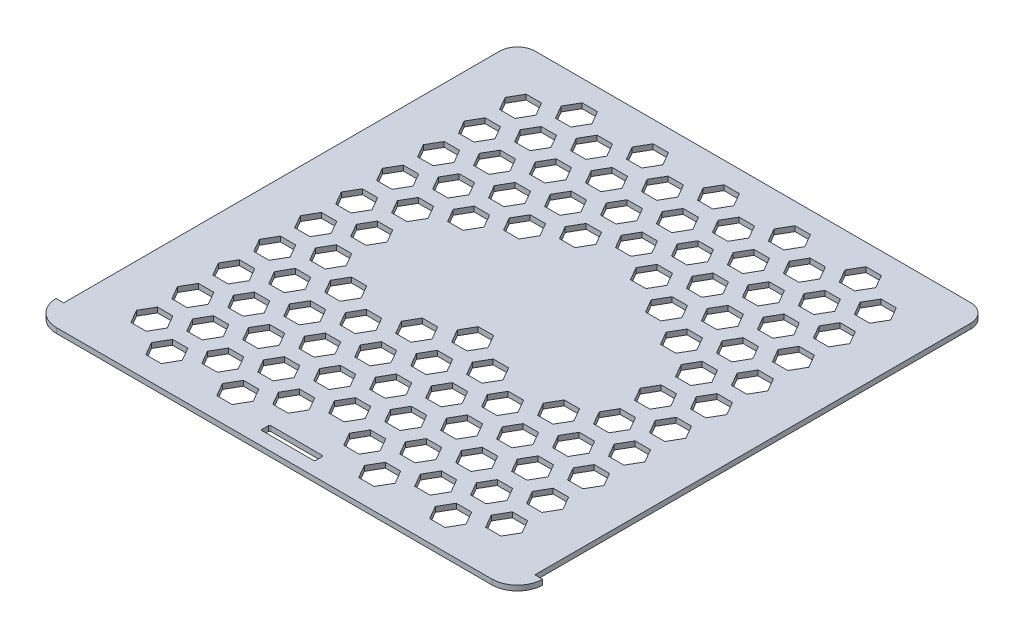
from build123d import *

# Parameters (mm, degrees)
ESQUISSE1_W                     = 184
ESQUISSE1_H                     = 187
BOSS_EXTRU_1_DEPTH              = 2
CONG_1_R                        = 7
ENL_V_MAT_EXTRU_1_DEPTH         = 132.187842425
BOSS_EXTRU_2_DEPTH              = 2
R_P_TITION_DANS_UNE_ZONE1_DEPTH = 2
ENL_V_MAT_EXTRU_2_REACH         = 135.307
ESQUISSE4_W                     = 21
ESQUISSE4_H                     = 3.4
CONG_2_R                        = 0.5


# Read off the part's stored shape, not the designer's step: Répétition dans une zone1
with BuildPart() as part:
    # Esquisse1 → Boss.-Extru.1 (new body)
    with BuildSketch(Plane(origin=(0, 0, 0), x_dir=(1, 0, 0), z_dir=(0, 1, 0))):
        Rectangle(ESQUISSE1_W, ESQUISSE1_H)
    extrude(amount=BOSS_EXTRU_1_DEPTH)

    # Congé1
    cong_1_edges = [part.edges().sort_by_distance(p)[0] for p in [
        (-92, 1, -93.5),
        (92, 1, -93.5),
    ]]
    fillet(cong_1_edges, radius=CONG_1_R)

    # Esquisse2 → Enlèv. mat.-Extru.1 (cut, through all)
    with BuildSketch(Plane(origin=(0, 2, 0), x_dir=(1, 0, 0), z_dir=(0, 1, 0))):
        with BuildLine():
            Line((-92, -90.641428429), (-92, -93.5))
            Line((-92, -93.5), (-85, -93.5))
            ThreePointArc((-85, -93.5), (-88.780589618, -92.757815193), (-92, -90.641428429))
        make_face()
    enl_v_mat_extru_1 = extrude(amount=-ENL_V_MAT_EXTRU_1_DEPTH, mode=Mode.SUBTRACT)

    # Esquisse3 → Boss.-Extru.2 (add)
    with BuildSketch(Plane(origin=(0, 2, 0), x_dir=(1, 0, 0), z_dir=(0, 1, 0))):
        with BuildLine():
            Line((-94.9979998, -83.7), (-92, -83.7))
            Line((-92, -83.7), (-92, -90.641428429))
            ThreePointArc((-92, -90.641428429), (-94.180351652, -87.464989728), (-94.9979998, -83.7))
        make_face()
    boss_extru_2 = extrude(amount=-BOSS_EXTRU_2_DEPTH)

    # Symétrie1: Enlèv. mat.-Extru.1, Boss.-Extru.2 across plane
    add(enl_v_mat_extru_1.mirror(Plane(origin=(0, 0, 0), x_dir=(0, 0, 1), z_dir=(1, 0, 0))), mode=Mode.SUBTRACT)
    add(boss_extru_2.mirror(Plane(origin=(0, 0, 0), x_dir=(0, 0, 1), z_dir=(1, 0, 0))))

    # Répétition dans une zone1 outline → Répétition dans une zone1 (cut)
    with BuildSketch(Plane(origin=(0, 0, 0), x_dir=(1, 0, 0), z_dir=(0, 1, 0))):
        Polygon((58.425625842, 74.803847577), (61.425625842, 80), (58.425625842, 85.196152423), (52.425625842, 85.196152423), (49.425625842, 80), (52.425625842, 74.803847577), align=None)
        Polygon((30.712812921, 26.803847577), (33.712812921, 32), (30.712812921, 37.196152423), (24.712812921, 37.196152423), (21.712812921, 32), (24.712812921, 26.803847577), align=None)
        Polygon((-10.856406461, -45.196152423), (-7.856406461, -40), (-10.856406461, -34.803847577), (-16.856406461, -34.803847577), (-19.856406461, -40), (-16.856406461, -45.196152423), align=None)
        Polygon((-24.712812921, -69.196152423), (-21.712812921, -64), (-24.712812921, -58.803847577), (-30.712812921, -58.803847577), (-33.712812921, -64), (-30.712812921, -69.196152423), align=None)
        Polygon((3, -21.196152423), (6, -16), (3, -10.803847577), (-3, -10.803847577), (-6, -16), (-3, -21.196152423), align=None)
        Polygon((44.569219382, 50.803847577), (47.569219382, 56), (44.569219382, 61.196152423), (38.569219382, 61.196152423), (35.569219382, 56), (38.569219382, 50.803847577), align=None)
        Polygon((75.282032303, 56), (72.282032303, 61.196152423), (66.282032303, 61.196152423), (63.282032303, 56), (66.282032303, 50.803847577), (72.282032303, 50.803847577), align=None)
        Polygon((-52.425625842, 85.196152423), (-58.425625842, 85.196152423), (-61.425625842, 80), (-58.425625842, 74.803847577), (-52.425625842, 74.803847577), (-49.425625842, 80), align=None)
        Polygon((-24.712812921, 85.196152423), (-30.712812921, 85.196152423), (-33.712812921, 80), (-30.712812921, 74.803847577), (-24.712812921, 74.803847577), (-21.712812921, 80), align=None)
        Polygon((30.712812921, 85.196152423), (24.712812921, 85.196152423), (21.712812921, 80), (24.712812921, 74.803847577), (30.712812921, 74.803847577), (33.712812921, 80), align=None)
        Polygon((3, 85.196152423), (-3, 85.196152423), (-6, 80), (-3, 74.803847577), (3, 74.803847577), (6, 80), align=None)
        Polygon((44.569219382, 18.803847577), (47.569219382, 24), (44.569219382, 29.196152423), (38.569219382, 29.196152423), (35.569219382, 24), (38.569219382, 18.803847577), align=None)
        Polygon((16.856406461, -29.196152423), (19.856406461, -24), (16.856406461, -18.803847577), (10.856406461, -18.803847577), (7.856406461, -24), (10.856406461, -29.196152423), align=None)
        Polygon((72.282032303, 66.803847577), (75.282032303, 72), (72.282032303, 77.196152423), (66.282032303, 77.196152423), (63.282032303, 72), (66.282032303, 66.803847577), align=None)
        Polygon((58.425625842, 42.803847577), (61.425625842, 48), (58.425625842, 53.196152423), (52.425625842, 53.196152423), (49.425625842, 48), (52.425625842, 42.803847577), align=None)
        Polygon((3, -53.196152423), (6, -48), (3, -42.803847577), (-3, -42.803847577), (-6, -48), (-3, -53.196152423), align=None)
        Polygon((-10.856406461, -77.196152423), (-7.856406461, -72), (-10.856406461, -66.803847577), (-16.856406461, -66.803847577), (-19.856406461, -72), (-16.856406461, -77.196152423), align=None)
        Polygon((75.282032303, -24), (72.282032303, -18.803847577), (66.282032303, -18.803847577), (63.282032303, -24), (66.282032303, -29.196152423), (72.282032303, -29.196152423), align=None)
        Polygon((61.425625842, 0), (58.425625842, 5.196152423), (52.425625842, 5.196152423), (49.425625842, 0), (52.425625842, -5.196152423), (58.425625842, -5.196152423), align=None)
        Polygon((19.856406461, 72), (16.856406461, 77.196152423), (10.856406461, 77.196152423), (7.856406461, 72), (10.856406461, 66.803847577), (16.856406461, 66.803847577), align=None)
        Polygon((33.712812921, 48), (30.712812921, 53.196152423), (24.712812921, 53.196152423), (21.712812921, 48), (24.712812921, 42.803847577), (30.712812921, 42.803847577), align=None)
        Polygon((72.282032303, 29.196152423), (66.282032303, 29.196152423), (63.282032303, 24), (66.282032303, 18.803847577), (72.282032303, 18.803847577), (75.282032303, 24), align=None)
        Polygon((-66.282032303, 29.196152423), (-72.282032303, 29.196152423), (-75.282032303, 24), (-72.282032303, 18.803847577), (-66.282032303, 18.803847577), (-63.282032303, 24), align=None)
        Polygon((-38.569219382, 29.196152423), (-44.569219382, 29.196152423), (-47.569219382, 24), (-44.569219382, 18.803847577), (-38.569219382, 18.803847577), (-35.569219382, 24), align=None)
        Polygon((30.712812921, -37.196152423), (33.712812921, -32), (30.712812921, -26.803847577), (24.712812921, -26.803847577), (21.712812921, -32), (24.712812921, -37.196152423), align=None)
        Polygon((58.425625842, 10.803847577), (61.425625842, 16), (58.425625842, 21.196152423), (52.425625842, 21.196152423), (49.425625842, 16), (52.425625842, 10.803847577), align=None)
        Polygon((16.856406461, -61.196152423), (19.856406461, -56), (16.856406461, -50.803847577), (10.856406461, -50.803847577), (7.856406461, -56), (10.856406461, -61.196152423), align=None)
        Polygon((72.282032303, 34.803847577), (75.282032303, 40), (72.282032303, 45.196152423), (66.282032303, 45.196152423), (63.282032303, 40), (66.282032303, 34.803847577), align=None)
        Polygon((61.425625842, -80), (58.425625842, -74.803847577), (52.425625842, -74.803847577), (49.425625842, -80), (52.425625842, -85.196152423), (58.425625842, -85.196152423), align=None)
        Polygon((47.569219382, -56), (44.569219382, -50.803847577), (38.569219382, -50.803847577), (35.569219382, -56), (38.569219382, -61.196152423), (44.569219382, -61.196152423), align=None)
        Polygon((-7.856406461, 40), (-10.856406461, 45.196152423), (-16.856406461, 45.196152423), (-19.856406461, 40), (-16.856406461, 34.803847577), (-10.856406461, 34.803847577), align=None)
        Polygon((-21.712812921, 64), (-24.712812921, 69.196152423), (-30.712812921, 69.196152423), (-33.712812921, 64), (-30.712812921, 58.803847577), (-24.712812921, 58.803847577), align=None)
        Polygon((58.425625842, -26.803847577), (52.425625842, -26.803847577), (49.425625842, -32), (52.425625842, -37.196152423), (58.425625842, -37.196152423), (61.425625842, -32), align=None)
        Polygon((-52.425625842, -26.803847577), (-58.425625842, -26.803847577), (-61.425625842, -32), (-58.425625842, -37.196152423), (-52.425625842, -37.196152423), (-49.425625842, -32), align=None)
        Polygon((3, -26.803847577), (-3, -26.803847577), (-6, -32), (-3, -37.196152423), (3, -37.196152423), (6, -32), align=None)
        Polygon((-24.712812921, -26.803847577), (-30.712812921, -26.803847577), (-33.712812921, -32), (-30.712812921, -37.196152423), (-24.712812921, -37.196152423), (-21.712812921, -32), align=None)
        Polygon((30.712812921, -53.196152423), (33.712812921, -48), (30.712812921, -42.803847577), (24.712812921, -42.803847577), (21.712812921, -48), (24.712812921, -53.196152423), align=None)
        Polygon((44.569219382, -29.196152423), (47.569219382, -24), (44.569219382, -18.803847577), (38.569219382, -18.803847577), (35.569219382, -24), (38.569219382, -29.196152423), align=None)
        Polygon((16.856406461, -77.196152423), (19.856406461, -72), (16.856406461, -66.803847577), (10.856406461, -66.803847577), (7.856406461, -72), (10.856406461, -77.196152423), align=None)
        Polygon((47.569219382, -72), (44.569219382, -66.803847577), (38.569219382, -66.803847577), (35.569219382, -72), (38.569219382, -77.196152423), (44.569219382, -77.196152423), align=None)
        Polygon((-35.569219382, 72), (-38.569219382, 77.196152423), (-44.569219382, 77.196152423), (-47.569219382, 72), (-44.569219382, 66.803847577), (-38.569219382, 66.803847577), align=None)
        Polygon((-21.712812921, 48), (-24.712812921, 53.196152423), (-30.712812921, 53.196152423), (-33.712812921, 48), (-30.712812921, 42.803847577), (-24.712812921, 42.803847577), align=None)
        Polygon((58.425625842, -42.803847577), (52.425625842, -42.803847577), (49.425625842, -48), (52.425625842, -53.196152423), (58.425625842, -53.196152423), (61.425625842, -48), align=None)
        Polygon((-52.425625842, -42.803847577), (-58.425625842, -42.803847577), (-61.425625842, -48), (-58.425625842, -53.196152423), (-52.425625842, -53.196152423), (-49.425625842, -48), align=None)
        Polygon((-24.712812921, -42.803847577), (-30.712812921, -42.803847577), (-33.712812921, -48), (-30.712812921, -53.196152423), (-24.712812921, -53.196152423), (-21.712812921, -48), align=None)
        Polygon((30.712812921, -69.196152423), (33.712812921, -64), (30.712812921, -58.803847577), (24.712812921, -58.803847577), (21.712812921, -64), (24.712812921, -69.196152423), align=None)
        Polygon((44.569219382, -45.196152423), (47.569219382, -40), (44.569219382, -34.803847577), (38.569219382, -34.803847577), (35.569219382, -40), (38.569219382, -45.196152423), align=None)
        Polygon((72.282032303, 2.803847577), (75.282032303, 8), (72.282032303, 13.196152423), (66.282032303, 13.196152423), (63.282032303, 8), (66.282032303, 2.803847577), align=None)
        Polygon((58.425625842, -21.196152423), (61.425625842, -16), (58.425625842, -10.803847577), (52.425625842, -10.803847577), (49.425625842, -16), (52.425625842, -21.196152423), align=None)
        Polygon((19.856406461, -40), (16.856406461, -34.803847577), (10.856406461, -34.803847577), (7.856406461, -40), (10.856406461, -45.196152423), (16.856406461, -45.196152423), align=None)
        Polygon((-35.569219382, 56), (-38.569219382, 61.196152423), (-44.569219382, 61.196152423), (-47.569219382, 56), (-44.569219382, 50.803847577), (-38.569219382, 50.803847577), align=None)
        Polygon((-21.712812921, 32), (-24.712812921, 37.196152423), (-30.712812921, 37.196152423), (-33.712812921, 32), (-30.712812921, 26.803847577), (-24.712812921, 26.803847577), align=None)
        Polygon((3, -58.803847577), (-3, -58.803847577), (-6, -64), (-3, -69.196152423), (3, -69.196152423), (6, -64), align=None)
        Polygon((58.425625842, -58.803847577), (52.425625842, -58.803847577), (49.425625842, -64), (52.425625842, -69.196152423), (58.425625842, -69.196152423), (61.425625842, -64), align=None)
        Polygon((-52.425625842, -58.803847577), (-58.425625842, -58.803847577), (-61.425625842, -64), (-58.425625842, -69.196152423), (-52.425625842, -69.196152423), (-49.425625842, -64), align=None)
        Polygon((-7.856406461, 56), (-10.856406461, 61.196152423), (-16.856406461, 61.196152423), (-19.856406461, 56), (-16.856406461, 50.803847577), (-10.856406461, 50.803847577), align=None)
        Polygon((72.282032303, -34.803847577), (66.282032303, -34.803847577), (63.282032303, -40), (66.282032303, -45.196152423), (72.282032303, -45.196152423), (75.282032303, -40), align=None)
        Polygon((-66.282032303, -34.803847577), (-72.282032303, -34.803847577), (-75.282032303, -40), (-72.282032303, -45.196152423), (-66.282032303, -45.196152423), (-63.282032303, -40), align=None)
        Polygon((-38.569219382, -34.803847577), (-44.569219382, -34.803847577), (-47.569219382, -40), (-44.569219382, -45.196152423), (-38.569219382, -45.196152423), (-35.569219382, -40), align=None)
        Polygon((75.282032303, -72), (72.282032303, -66.803847577), (66.282032303, -66.803847577), (63.282032303, -72), (66.282032303, -77.196152423), (72.282032303, -77.196152423), align=None)
        Polygon((-7.856406461, 72), (-10.856406461, 77.196152423), (-16.856406461, 77.196152423), (-19.856406461, 72), (-16.856406461, 66.803847577), (-10.856406461, 66.803847577), align=None)
        Polygon((6, 48), (3, 53.196152423), (-3, 53.196152423), (-6, 48), (-3, 42.803847577), (3, 42.803847577), align=None)
        Polygon((-66.282032303, -18.803847577), (-72.282032303, -18.803847577), (-75.282032303, -24), (-72.282032303, -29.196152423), (-66.282032303, -29.196152423), (-63.282032303, -24), align=None)
        Polygon((-10.856406461, -18.803847577), (-16.856406461, -18.803847577), (-19.856406461, -24), (-16.856406461, -29.196152423), (-10.856406461, -29.196152423), (-7.856406461, -24), align=None)
        Polygon((-38.569219382, -18.803847577), (-44.569219382, -18.803847577), (-47.569219382, -24), (-44.569219382, -29.196152423), (-38.569219382, -29.196152423), (-35.569219382, -24), align=None)
        Polygon((75.282032303, -8), (72.282032303, -2.803847577), (66.282032303, -2.803847577), (63.282032303, -8), (66.282032303, -13.196152423), (72.282032303, -13.196152423), align=None)
        Polygon((33.712812921, 64), (30.712812921, 69.196152423), (24.712812921, 69.196152423), (21.712812921, 64), (24.712812921, 58.803847577), (30.712812921, 58.803847577), align=None)
        Polygon((47.569219382, 40), (44.569219382, 45.196152423), (38.569219382, 45.196152423), (35.569219382, 40), (38.569219382, 34.803847577), (44.569219382, 34.803847577), align=None)
        Polygon((-52.425625842, 21.196152423), (-58.425625842, 21.196152423), (-61.425625842, 16), (-58.425625842, 10.803847577), (-52.425625842, 10.803847577), (-49.425625842, 16), align=None)
        Polygon((30.712812921, -85.196152423), (33.712812921, -80), (30.712812921, -74.803847577), (24.712812921, -74.803847577), (21.712812921, -80), (24.712812921, -85.196152423), align=None)
        Polygon((-49.425625842, 64), (-52.425625842, 69.196152423), (-58.425625842, 69.196152423), (-61.425625842, 64), (-58.425625842, 58.803847577), (-52.425625842, 58.803847577), align=None)
        Polygon((-35.569219382, 40), (-38.569219382, 45.196152423), (-44.569219382, 45.196152423), (-47.569219382, 40), (-44.569219382, 34.803847577), (-38.569219382, 34.803847577), align=None)
        Polygon((-52.425625842, -74.803847577), (-58.425625842, -74.803847577), (-61.425625842, -80), (-58.425625842, -85.196152423), (-52.425625842, -85.196152423), (-49.425625842, -80), align=None)
        Polygon((-24.712812921, -74.803847577), (-30.712812921, -74.803847577), (-33.712812921, -80), (-30.712812921, -85.196152423), (-24.712812921, -85.196152423), (-21.712812921, -80), align=None)
        Polygon((19.856406461, 56), (16.856406461, 61.196152423), (10.856406461, 61.196152423), (7.856406461, 56), (10.856406461, 50.803847577), (16.856406461, 50.803847577), align=None)
        Polygon((58.425625842, 37.196152423), (52.425625842, 37.196152423), (49.425625842, 32), (52.425625842, 26.803847577), (58.425625842, 26.803847577), (61.425625842, 32), align=None)
        Polygon((-52.425625842, 37.196152423), (-58.425625842, 37.196152423), (-61.425625842, 32), (-58.425625842, 26.803847577), (-52.425625842, 26.803847577), (-49.425625842, 32), align=None)
        Polygon((-63.282032303, 56), (-66.282032303, 61.196152423), (-72.282032303, 61.196152423), (-75.282032303, 56), (-72.282032303, 50.803847577), (-66.282032303, 50.803847577), align=None)
        Polygon((47.569219382, 72), (44.569219382, 77.196152423), (38.569219382, 77.196152423), (35.569219382, 72), (38.569219382, 66.803847577), (44.569219382, 66.803847577), align=None)
        Polygon((-49.425625842, 48), (-52.425625842, 53.196152423), (-58.425625842, 53.196152423), (-61.425625842, 48), (-58.425625842, 42.803847577), (-52.425625842, 42.803847577), align=None)
        Polygon((-63.282032303, 72), (-66.282032303, 77.196152423), (-72.282032303, 77.196152423), (-75.282032303, 72), (-72.282032303, 66.803847577), (-66.282032303, 66.803847577), align=None)
        Polygon((-66.282032303, -66.803847577), (-72.282032303, -66.803847577), (-75.282032303, -72), (-72.282032303, -77.196152423), (-66.282032303, -77.196152423), (-63.282032303, -72), align=None)
        Polygon((-38.569219382, -66.803847577), (-44.569219382, -66.803847577), (-47.569219382, -72), (-44.569219382, -77.196152423), (-38.569219382, -77.196152423), (-35.569219382, -72), align=None)
        Polygon((72.282032303, -50.803847577), (66.282032303, -50.803847577), (63.282032303, -56), (66.282032303, -61.196152423), (72.282032303, -61.196152423), (75.282032303, -56), align=None)
        Polygon((-66.282032303, -50.803847577), (-72.282032303, -50.803847577), (-75.282032303, -56), (-72.282032303, -61.196152423), (-66.282032303, -61.196152423), (-63.282032303, -56), align=None)
        Polygon((-10.856406461, -50.803847577), (-16.856406461, -50.803847577), (-19.856406461, -56), (-16.856406461, -61.196152423), (-10.856406461, -61.196152423), (-7.856406461, -56), align=None)
        Polygon((-38.569219382, -50.803847577), (-44.569219382, -50.803847577), (-47.569219382, -56), (-44.569219382, -61.196152423), (-38.569219382, -61.196152423), (-35.569219382, -56), align=None)
        Polygon((-66.282032303, -2.803847577), (-72.282032303, -2.803847577), (-75.282032303, -8), (-72.282032303, -13.196152423), (-66.282032303, -13.196152423), (-63.282032303, -8), align=None)
        Polygon((19.856406461, 40), (16.856406461, 45.196152423), (10.856406461, 45.196152423), (7.856406461, 40), (10.856406461, 34.803847577), (16.856406461, 34.803847577), align=None)
        Polygon((6, 64), (3, 69.196152423), (-3, 69.196152423), (-6, 64), (-3, 58.803847577), (3, 58.803847577), align=None)
        Polygon((-66.282032303, 13.196152423), (-72.282032303, 13.196152423), (-75.282032303, 8), (-72.282032303, 2.803847577), (-66.282032303, 2.803847577), (-63.282032303, 8), align=None)
        Polygon((-52.425625842, 5.196152423), (-58.425625842, 5.196152423), (-61.425625842, 0), (-58.425625842, -5.196152423), (-52.425625842, -5.196152423), (-49.425625842, 0), align=None)
        Polygon((-52.425625842, -10.803847577), (-58.425625842, -10.803847577), (-61.425625842, -16), (-58.425625842, -21.196152423), (-52.425625842, -21.196152423), (-49.425625842, -16), align=None)
        Polygon((58.425625842, 58.803847577), (61.425625842, 64), (58.425625842, 69.196152423), (52.425625842, 69.196152423), (49.425625842, 64), (52.425625842, 58.803847577), align=None)
        Polygon((-66.282032303, 34.803847577), (-63.282032303, 40), (-66.282032303, 45.196152423), (-72.282032303, 45.196152423), (-75.282032303, 40), (-72.282032303, 34.803847577), align=None)
    extrude(amount=R_P_TITION_DANS_UNE_ZONE1_DEPTH, mode=Mode.SUBTRACT)

    # Esquisse4 → Enlèv. mat.-Extru.2 (cut, up to next)
    with BuildSketch(Plane(origin=(0, 2, 0), x_dir=(1, 0, 0), z_dir=(0, 1, 0)), mode=Mode.PRIVATE) as enl_v_mat_extru_2_sk1:
        with Locations((0, -86.5)):
            Rectangle(ESQUISSE4_W, ESQUISSE4_H)
    enl_v_mat_extru_2_tool1 = extrude(enl_v_mat_extru_2_sk1.sketch, amount=-ENL_V_MAT_EXTRU_2_REACH, mode=Mode.PRIVATE) & part.part
    add(enl_v_mat_extru_2_tool1.solids().sort_by_distance((0, 2, 86.5))[0], mode=Mode.SUBTRACT)

    # Congé2
    cong_2_edges = [part.edges().sort_by_distance(p)[0] for p in [
        (10.5, 1, 84.8),
        (10.5, 1, 88.2),
        (-10.5, 1, 88.2),
        (-10.5, 1, 84.8),
    ]]
    fillet(cong_2_edges, radius=CONG_2_R)


solid = part.part
